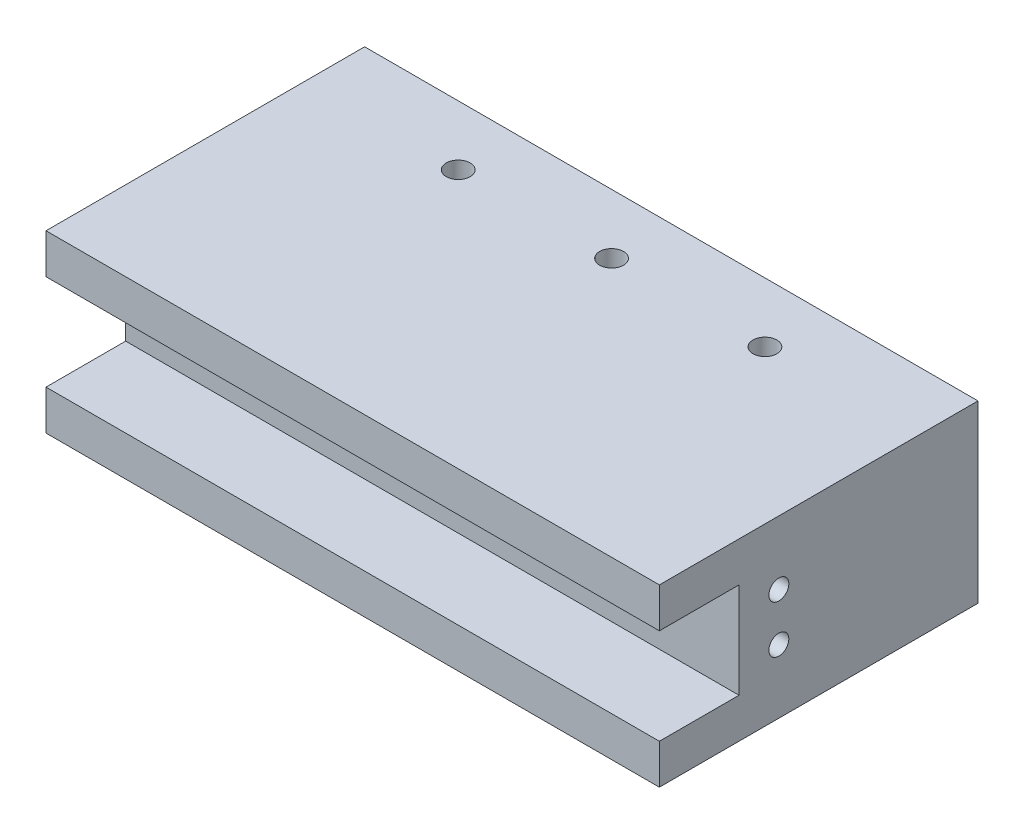
from build123d import *

# Parameters (mm, degrees)
SKETCH1_W               = 77
SKETCH1_H               = 12
BOSS_EXTRUDE1_DEPTH     = 10
SKETCH2_R               = 1.25
CUT_EXTRUDE1_DEPTH      = 12
BOSS_EXTRUDE2_OUTLINE_W = 77
BOSS_EXTRUDE2_OUTLINE_H = 20
BOSS_EXTRUDE2_DEPTH     = 5
SKETCH4_W               = 77
SKETCH4_H               = 22
BOSS_EXTRUDE3_DEPTH     = 5
SKETCH5_R               = 1.25
CUT_EXTRUDE2_DEPTH      = 12
SKETCH7_W               = 77
SKETCH7_H               = 22
BOSS_EXTRUDE4_DEPTH     = 15
SKETCH8_R               = 1.5
CUT_EXTRUDE3_DEPTH      = 83.540898953


# Read off the part's stored shape, not the designer's step: Boss-Extrude2
with BuildPart() as part:
    # Sketch1 → Boss-Extrude1 (new body)
    with BuildSketch(Plane.XY):
        with Locations((38.5, 6)):
            Rectangle(SKETCH1_W, SKETCH1_H)
    extrude(amount=BOSS_EXTRUDE1_DEPTH)

    # Sketch2 → Cut-Extrude1 (cut)
    with BuildSketch(Plane(origin=(77, 0, 0), x_dir=(0, 0, -1), z_dir=(1, 0, 0))):
        with Locations((-5, 3)):
            Circle(SKETCH2_R)
        with Locations((-5, 9)):
            Circle(SKETCH2_R)
    extrude(amount=-CUT_EXTRUDE1_DEPTH, mode=Mode.SUBTRACT)

    # Boss-Extrude2 outline → Boss-Extrude2 (add)
    with BuildSketch(Plane(origin=(0, 12, 0), x_dir=(1, 0, 0), z_dir=(0, 1, 0))):
        with Locations((38.5, -10)):
            Rectangle(BOSS_EXTRUDE2_OUTLINE_W, BOSS_EXTRUDE2_OUTLINE_H)
    boss_extrude2 = extrude(amount=BOSS_EXTRUDE2_DEPTH)

    # Mirror2: Boss-Extrude2 across plane
    add(boss_extrude2.mirror(Plane(origin=(0, 6, 0), x_dir=(0, 0, 1), z_dir=(0, -1, 0))))

    # Sketch4 → Boss-Extrude3 (add)
    with BuildSketch(Plane(origin=(0, 0, 0), x_dir=(-1, 0, 0), z_dir=(0, 0, -1))):
        with Locations((-38.5, 6)):
            Rectangle(SKETCH4_W, SKETCH4_H)
    extrude(amount=BOSS_EXTRUDE3_DEPTH)

    # Sketch5 → Cut-Extrude2 (cut)
    with BuildSketch(Plane.ZY):
        with Locations((6, 6)):
            Circle(SKETCH5_R)
    extrude(amount=-CUT_EXTRUDE2_DEPTH, mode=Mode.SUBTRACT)

    # Sketch7 → Boss-Extrude4 (add)
    with BuildSketch(Plane(origin=(0, 0, -5), x_dir=(-1, 0, 0), z_dir=(0, 0, -1))):
        with Locations((-38.5, 6)):
            Rectangle(SKETCH7_W, SKETCH7_H)
    extrude(amount=BOSS_EXTRUDE4_DEPTH)

    # Sketch8 → Cut-Extrude3 (cut, through all)
    with BuildSketch(Plane.XZ.offset(5)):
        with Locations((19.25, -12.5)):
            Circle(SKETCH8_R)
        with Locations((38.5, -12.5)):
            Circle(SKETCH8_R)
        with Locations((57.75, -12.5)):
            Circle(SKETCH8_R)
    extrude(amount=-CUT_EXTRUDE3_DEPTH, mode=Mode.SUBTRACT)


solid = part.part
